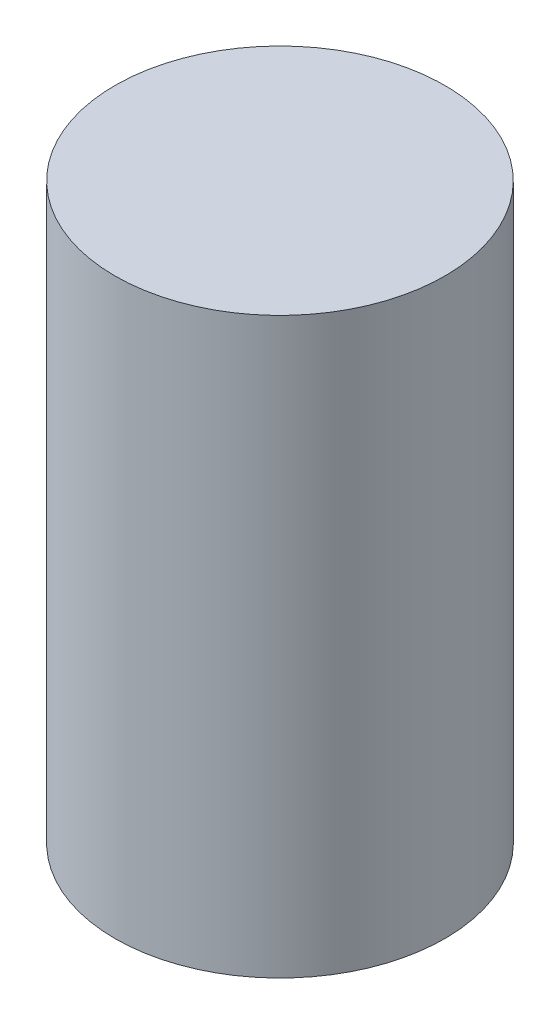
from build123d import *

# Parameters (mm, degrees)
SKETCH2_R           = 6.9
BOSS_EXTRUDE1_DEPTH = 24


with BuildPart() as part:
    # Sketch2 → Boss-Extrude1 (new body)
    with BuildSketch(Plane(origin=(0, 0, 0), x_dir=(1, 0, 0), z_dir=(0, 1, 0))):
        Circle(SKETCH2_R)
    extrude(amount=BOSS_EXTRUDE1_DEPTH)


solid = part.part
